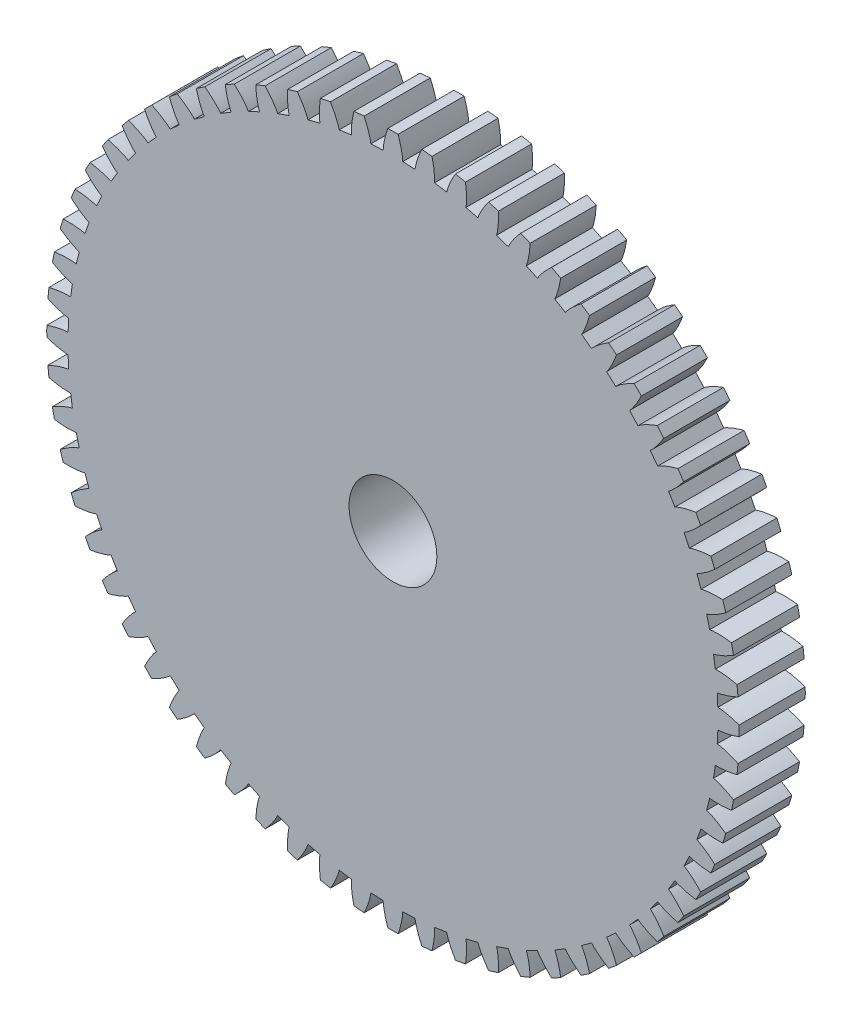
from build123d import *

# Parameters (mm, degrees)
SKETCH1_R               = 52.3875
BOSS_EXTRUDE1_DEPTH     = 10
CUT_EXTRUDE2_DEPTH      = 11
CIRPATTERN1_COUNT       = 64
CUT_EXTRUDE4_DEPTH      = 12
CUT_EXTRUDE4_DEPTH_BACK = 12
SKETCH3_R               = 6.6421


with BuildPart() as part:
    # Sketch1 → Boss-Extrude1 (new body)
    with BuildSketch(Plane.XY):
        Circle(SKETCH1_R)
    extrude(amount=BOSS_EXTRUDE1_DEPTH)

    # Sketch2 → Cut-Extrude2 (cut, symmetric)
    with BuildSketch(Plane.XY):
        with BuildLine():
            add(Edge.make_bspline(
                [(49.159639133, 1.479588071), (49.164532349, 1.479697342), (49.178261104, 1.479886221), (49.204235196, 1.479778867), (49.246654771, 1.478943821), (49.300763008, 1.476909208), (49.370777189, 1.473163832), (49.453364186, 1.467315202), (49.544251653, 1.45938075), (49.643281434, 1.449119138), (49.742216894, 1.437438853), (49.841046626, 1.424441558), (49.939623832, 1.41027914), (50.059190432, 1.391684559), (50.202785797, 1.367385769), (50.370974222, 1.336057228), (50.562150691, 1.297065366), (50.757484667, 1.253608942), (50.950107555, 1.207789278), (51.145239697, 1.157959763), (51.334405913, 1.107242401), (51.53146561, 1.050918271), (51.71364732, 0.997077963), (51.918436872, 0.93270049), (52.083896995, 0.879565753), (52.255414681, 0.821277521), (52.33898356, 0.792405599), (52.381731035, 0.777438111)],
                knots=[0, 0, 0, 0, 0, 0.005376749, 0.015083688, 0.02853182, 0.04661014, 0.06485485, 0.092110526, 0.119476176, 0.146842496, 0.174208854, 0.201574956, 0.228941013, 0.256307345, 0.307035032, 0.361767352, 0.416499661, 0.471231937, 0.525964282, 0.580696616, 0.635428982, 0.690161387, 0.744893688, 0.799626082, 0.854358407, 0.909090914, 0.909090914, 0.909090914, 0.909090914, 0.909090914], degree=4))
            Line((52.381731035, 0.777438111), (59.993392739, 0.890408717))
            add(Edge.make_bspline(
                [(59.993392739, 0.890408717), (59.992787708, 0.931174102), (59.991502941, 1.010570522), (59.988055764, 1.210584827), (59.984507625, 1.36359621), (59.979310115, 1.584822535), (59.974081063, 1.765001958), (59.96785059, 1.969926675), (59.961196969, 2.159896403), (59.953784069, 2.358788491), (59.945792547, 2.552406181), (59.937151262, 2.748893749), (59.927840416, 2.944066013), (59.917976201, 3.139211092), (59.907316726, 3.335599513), (59.896291914, 3.529068186), (59.884174285, 3.727729146), (59.872175577, 3.917436287), (59.858289914, 4.121984928), (59.845833116, 4.301809275), (59.829321627, 4.52247978), (59.817854942, 4.67510215), (59.80168069, 4.874491213), (59.79517706, 4.953631247), (59.791783471, 4.994259639)],
                knots=[0.083333333, 0.083333333, 0.083333333, 0.083333333, 0.083333333, 0.123015873, 0.162698413, 0.202380952, 0.242063492, 0.281746032, 0.321428571, 0.361111111, 0.400793651, 0.44047619, 0.48015873, 0.51984127, 0.55952381, 0.599206349, 0.638888889, 0.678571429, 0.718253968, 0.757936508, 0.797619048, 0.837301587, 0.876984127, 0.916666667, 0.916666667, 0.916666667, 0.916666667, 0.916666667], degree=4))
            Line((59.791783471, 4.994259639), (52.205700943, 4.360612948))
            add(Edge.make_bspline(
                [(49.067947025, 3.346023798), (49.07282739, 3.346394672), (49.08650855, 3.347552356), (49.112347047, 3.350205099), (49.154480512, 3.355193969), (49.208128776, 3.36252232), (49.277438709, 3.37311225), (49.359054761, 3.387027659), (49.448726867, 3.403832434), (49.546273979, 3.423751249), (49.64358817, 3.445072661), (49.740668052, 3.467694379), (49.837382422, 3.491450857), (49.954550689, 3.521675475), (50.095072905, 3.559932068), (50.259380723, 3.607595101), (50.445814753, 3.665137778), (50.635948668, 3.727531025), (50.823152912, 3.7920104), (51.012461293, 3.860726266), (51.195745451, 3.929740942), (51.386335522, 4.005109084), (51.562362704, 4.076547066), (51.759856042, 4.16068743), (51.919311315, 4.229784237), (52.08428985, 4.304603468), (52.164626379, 4.341527547), (52.205700943, 4.360612948)],
                knots=[0, 0, 0, 0, 0, 0.005376749, 0.015083688, 0.02853182, 0.04661014, 0.06485485, 0.092110526, 0.119476176, 0.146842496, 0.174208854, 0.201574956, 0.228941013, 0.256307345, 0.307035032, 0.361767352, 0.416499661, 0.471231937, 0.525964282, 0.580696616, 0.635428982, 0.690161387, 0.744893688, 0.799626082, 0.854358407, 0.909090914, 0.909090914, 0.909090914, 0.909090914, 0.909090914], degree=4))
            Line((49.067947025, 3.346023798), (49.159639133, 1.479588071))
        make_face()
    cut_extrude2 = extrude(amount=CUT_EXTRUDE2_DEPTH, both=True, mode=Mode.SUBTRACT)

    # CirPattern1: Cut-Extrude2 ×64 about axis
    cirpattern1_axis = Axis((0, 0, -0.5), (0, 0, 1))
    for i in range(1, CIRPATTERN1_COUNT):
        add(cut_extrude2.rotate(cirpattern1_axis, i * 360 / CIRPATTERN1_COUNT), mode=Mode.SUBTRACT)

    # Sketch3 → Cut-Extrude4 (cut, two sides: drawn at the far end of the back side and taken through both)
    with BuildSketch(Plane.XY.offset(-CUT_EXTRUDE4_DEPTH_BACK)):
        Circle(SKETCH3_R)
    extrude(amount=CUT_EXTRUDE4_DEPTH + CUT_EXTRUDE4_DEPTH_BACK, mode=Mode.SUBTRACT)


solid = part.part
